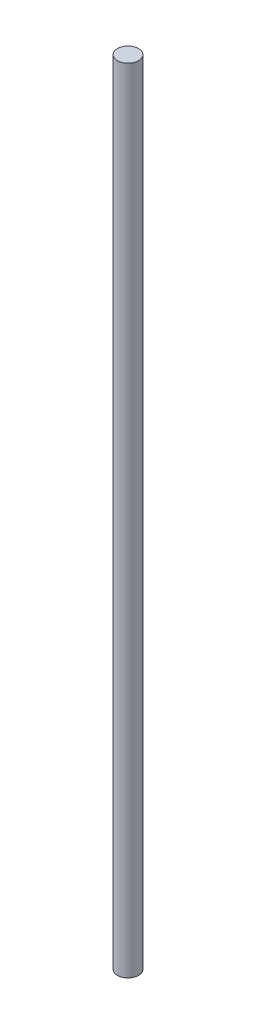
from build123d import *

# Parameters (mm, degrees)
SKETCH1_R           = 4
BOSS_EXTRUDE1_DEPTH = 300


with BuildPart() as part:
    # Sketch1 → Boss-Extrude1 (new body)
    with BuildSketch(Plane(origin=(0, 0, 0), x_dir=(1, 0, 0), z_dir=(0, 1, 0))):
        Circle(SKETCH1_R)
    extrude(amount=BOSS_EXTRUDE1_DEPTH)


solid = part.part
